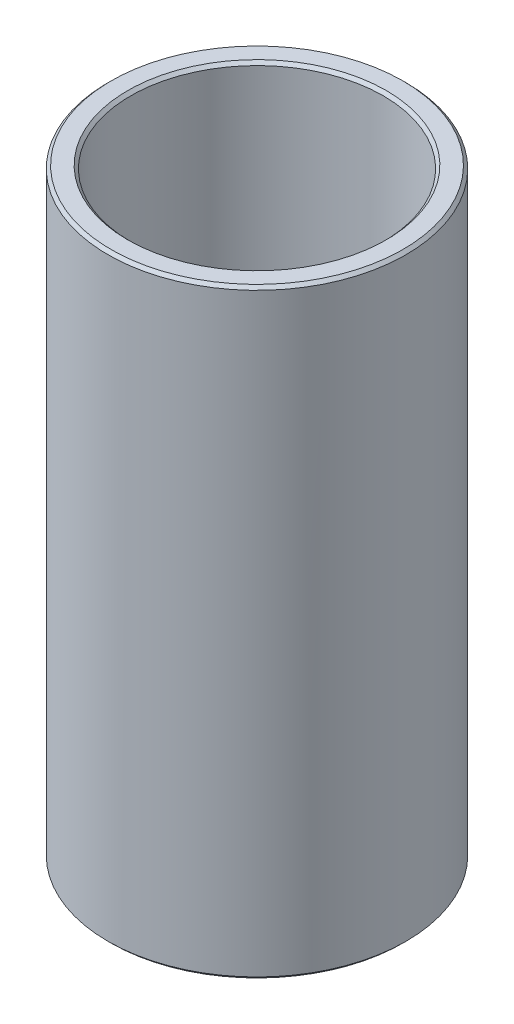
from build123d import *

# Parameters (mm, degrees)
SKETCH1_R           = 55
BOSS_EXTRUDE1_DEPTH = 221.697302935
SKETCH2_R           = 46.615045303
CUT_EXTRUDE1_DEPTH  = 235.946151551
CHAMFER1_SIZE       = 1.117094297


with BuildPart() as part:
    # Sketch1 → Boss-Extrude1 (new body)
    with BuildSketch(Plane(origin=(0, 0, 0), x_dir=(1, 0, 0), z_dir=(0, 1, 0))):
        Circle(SKETCH1_R)
    extrude(amount=BOSS_EXTRUDE1_DEPTH)

    # Sketch2 → Cut-Extrude1 (cut, through all)
    with BuildSketch(Plane(origin=(0, 0, 0), x_dir=(1, 0, 0), z_dir=(0, 1, 0))):
        Circle(SKETCH2_R)
    extrude(amount=CUT_EXTRUDE1_DEPTH, mode=Mode.SUBTRACT)

    # Chamfer1
    chamfer1_edges = [part.edges().sort_by_distance(p)[0] for p in [
        (-46.615045303, 221.697302935, 0),
        (-46.615045303, 0, 0),
        (-55, 0, 0),
        (-55, 221.697302935, 0),
    ]]
    chamfer(chamfer1_edges, length=CHAMFER1_SIZE)


solid = part.part
